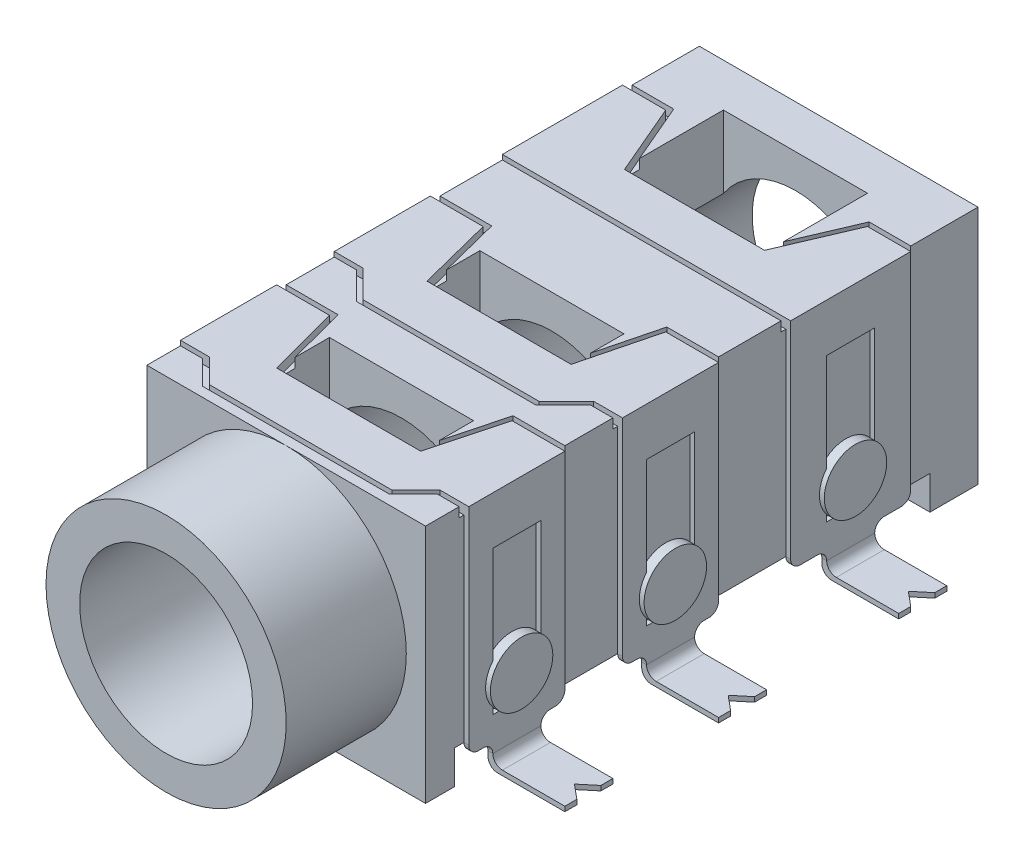
from build123d import *
from build123d.topology import SkipClean

# Parameters (mm, degrees)
CROQUIS1_W              = 5.8
CROQUIS1_H              = 5
CROQUIS1_R              = 1.8
SALIENTE_EXTRUIR1_DEPTH = 11.5
SALIENTE_EXTRUIR2_START = 2.5
CROQUIS2_R              = 2.5
CROQUIS2_R_2            = 1.8
SALIENTE_EXTRUIR2_DEPTH = 2.5
CROQUIS4_W              = 2
CROQUIS4_H              = 5
CROQUIS4_W_2            = 2.5
SALIENTE_EXTRUIR4_DEPTH = 0.1
CROQUIS5_W              = 1
CROQUIS5_H              = 0.1
SALIENTE_EXTRUIR5_DEPTH = 1.5
CROQUIS6_W              = 5.8
CROQUIS6_H              = 0.1
CORTAR_EXTRUIR1_DEPTH   = 0.2
CORTAR_EXTRUIR2_REACH   = 15.323
CROQUIS7_W              = 3
CROQUIS7_H              = 1
CROQUIS7_H_2            = 2
CROQUIS8_W              = 1
CROQUIS8_H              = 3
CORTAR_EXTRUIR3_DEPTH   = 0.1
CROQUIS9_R              = 0.65
SALIENTE_EXTRUIR8_DEPTH = 0.2
CORTAR_EXTRUIR4_START   = -0.6
CORTAR_EXTRUIR4_DEPTH   = 9.9
SALIENTE_EXTRUIR9_START = -0.115152
CROQUIS11_R             = 0.75
SALIENTE_EXTRUIR9_DEPTH = 1.115152
CORTAR_EXTRUIR5_REACH   = 15.286
CORTAR_EXTRUIR6_REACH   = 16.169
CROQUIS13_W             = 0.5
CROQUIS13_H             = 0.5
CROQUIS13_W_2           = 0.75
REDONDEO1_START         = -3.055616
REDONDEO1_DEPTH         = 0.155616
REDONDEO1_START_2       = 2.9
REDONDEO1_2_DEPTH       = 0.151008
REDONDEO1_START_3       = -2.909726
REDONDEO1_3_OUTLINE_W   = 0.1
REDONDEO1_3_OUTLINE_H   = 1
REDONDEO1_3_DEPTH       = 0.009726
REDONDEO1_4_OUTLINE_W   = 0.1
REDONDEO1_4_OUTLINE_H   = 1
REDONDEO1_4_DEPTH       = 0.009726
REDONDEO1_START_4       = -3
REDONDEO1_5_DEPTH       = 0.1
REDONDEO1_6_DEPTH       = 0.1
REDONDEO1_START_5       = -9.25
REDONDEO1_7_DEPTH       = 1
REDONDEO1_START_6       = -5.5
REDONDEO1_8_DEPTH       = 1
REDONDEO1_START_7       = -2.3
REDONDEO1_9_DEPTH       = 1
REDONDEO1_START_8       = -4
REDONDEO1_10_DEPTH      = 1.1
REDONDEO1_11_DEPTH      = 1.1
REDONDEO1_12_DEPTH      = 7.95


with BuildPart() as part:
    # Croquis1 → Saliente-Extruir1 (new body)
    with BuildSketch(Plane.XY):
        Rectangle(CROQUIS1_W, CROQUIS1_H)
        Circle(CROQUIS1_R, mode=Mode.SUBTRACT)
    extrude(amount=-SALIENTE_EXTRUIR1_DEPTH)

    # Croquis2 → Saliente-Extruir2 (add)
    with BuildSketch(Plane.XY.offset(SALIENTE_EXTRUIR2_START)):
        with Locations(Location((0, 0, 0), (0, 0, 270))):
            Circle(CROQUIS2_R)
        Circle(CROQUIS2_R_2, mode=Mode.SUBTRACT)
    extrude(amount=-SALIENTE_EXTRUIR2_DEPTH)

    # Croquis4 → Saliente-Extruir4 (add)
    with BuildSketch(Plane(origin=(2.9, 0, 0), x_dir=(0, 0, -1), z_dir=(1, 0, 0))):
        with Locations((1.8, 0)):
            Rectangle(CROQUIS4_W, CROQUIS4_H)
        with Locations((5, 0)):
            Rectangle(CROQUIS4_W, CROQUIS4_H)
        with Locations((8.75, 0)):
            Rectangle(CROQUIS4_W_2, CROQUIS4_H)
    saliente_extruir4 = extrude(amount=SALIENTE_EXTRUIR4_DEPTH)

    # Croquis5 → Saliente-Extruir5 (add)
    with BuildSketch(Plane(origin=(3, 0, 0), x_dir=(0, 0, -1), z_dir=(1, 0, 0))):
        with Locations((1.8, -2.45)):
            Rectangle(CROQUIS5_W, CROQUIS5_H)
        with Locations((5, -2.45)):
            Rectangle(CROQUIS5_W, CROQUIS5_H)
        with Locations((8.75, -2.45)):
            Rectangle(CROQUIS5_W, CROQUIS5_H)
    saliente_extruir5 = extrude(amount=SALIENTE_EXTRUIR5_DEPTH)

    # Simetría1: Saliente-Extruir4, Saliente-Extruir5 across plane
    add(saliente_extruir4.mirror(Plane(origin=(0, 0, 0), x_dir=(0, 0, 1), z_dir=(1, 0, 0))))
    add(saliente_extruir5.mirror(Plane(origin=(0, 0, 0), x_dir=(0, 0, 1), z_dir=(1, 0, 0))))

    # Croquis6 → Cortar-Extruir1 (cut)
    with BuildSketch(Plane(origin=(0, 2.5, 0), x_dir=(1, 0, 0), z_dir=(0, 1, 0))):
        Polygon((-2.9, 0.8), (-2.4, 0.8), (-1.9, 0.3), (1.9, 0.3), (2.4, 0.8), (2.9, 0.8), (2.9, 0.7), (2.441421356, 0.7), (1.941421356, 0.2), (-1.941421356, 0.2), (-2.441421356, 0.7), (-2.9, 0.7), align=None)
        Polygon((-2.9, 2.8), (-1.9, 2.8), (-1.5, 1.3), (1.5, 1.3), (1.9, 2.8), (2.9, 2.8), (2.9, 2.9), (1.823172169, 2.9), (1.423172169, 1.4), (-1.423172169, 1.4), (-1.823172169, 2.9), (-2.9, 2.9), align=None)
        Polygon((-2.9, 4), (-2.4, 4), (-1.830451108, 3.430451108), (1.830451108, 3.430451108), (2.4, 4), (2.9, 4), (2.9, 3.9), (2.441421356, 3.9), (1.871872464, 3.330451108), (-1.871872464, 3.330451108), (-2.441421356, 3.9), (-2.9, 3.9), align=None)
        Polygon((-2.9, 6), (-1.9, 6), (-1.5, 4.430451108), (1.5, 4.430451108), (1.9, 6), (2.9, 6), (2.9, 6.1), (1.822288679, 6.1), (1.422288679, 4.530451108), (-1.422288679, 4.530451108), (-1.822288679, 6.1), (-2.9, 6.1), align=None)
        with Locations((0, 7.45)):
            Rectangle(CROQUIS6_W, CROQUIS6_H)
        Polygon((-2.9, 10), (-2.1, 10), (-1.458102489, 8.5), (1.458102489, 8.5), (2.1, 10), (2.9, 10), (2.9, 10.1), (2.034021594, 10.1), (1.392124083, 8.6), (-1.392124083, 8.6), (-2.034021594, 10.1), (-2.9, 10.1), align=None)
    extrude(amount=-CORTAR_EXTRUIR1_DEPTH, mode=Mode.SUBTRACT)

    # Croquis7 → Cortar-Extruir2 (cut, up to next)
    with BuildSketch(Plane(origin=(0, 2.5, 0), x_dir=(1, 0, 0), z_dir=(0, 1, 0)), mode=Mode.PRIVATE) as cortar_extruir2_sk1:
        with Locations((0, 1.9)):
            Rectangle(CROQUIS7_W, CROQUIS7_H)
    cortar_extruir2_tool1 = extrude(cortar_extruir2_sk1.sketch, amount=-CORTAR_EXTRUIR2_REACH, mode=Mode.PRIVATE) & part.part
    # Croquis7 → Cortar-Extruir2 (cut, up to next)
    with BuildSketch(Plane(origin=(0, 2.5, 0), x_dir=(1, 0, 0), z_dir=(0, 1, 0)), mode=Mode.PRIVATE) as cortar_extruir2_sk2:
        with Locations((0, 5.030451108)):
            Rectangle(CROQUIS7_W, CROQUIS7_H)
    cortar_extruir2_tool2 = extrude(cortar_extruir2_sk2.sketch, amount=-CORTAR_EXTRUIR2_REACH, mode=Mode.PRIVATE) & part.part
    # Croquis7 → Cortar-Extruir2 (cut, up to next)
    with BuildSketch(Plane(origin=(0, 2.5, 0), x_dir=(1, 0, 0), z_dir=(0, 1, 0)), mode=Mode.PRIVATE) as cortar_extruir2_sk3:
        with Locations((0, 9.6)):
            Rectangle(CROQUIS7_W, CROQUIS7_H_2)
    cortar_extruir2_tool3 = extrude(cortar_extruir2_sk3.sketch, amount=-CORTAR_EXTRUIR2_REACH, mode=Mode.PRIVATE) & part.part
    add(cortar_extruir2_tool1.solids().sort_by_distance((0, 2.5, -1.9))[0], mode=Mode.SUBTRACT)
    add(cortar_extruir2_tool2.solids().sort_by_distance((0, 2.5, -5.030451))[0], mode=Mode.SUBTRACT)
    add(cortar_extruir2_tool3.solids().sort_by_distance((0, 2.5, -9.6))[0], mode=Mode.SUBTRACT)

    # Croquis8 → Cortar-Extruir3 (cut)
    with BuildSketch(Plane(origin=(3, 0, 0), x_dir=(0, 0, -1), z_dir=(1, 0, 0))):
        with Locations((1.8, 0)):
            Rectangle(CROQUIS8_W, CROQUIS8_H)
        with Locations((5, 0)):
            Rectangle(CROQUIS8_W, CROQUIS8_H)
        with Locations((8.75, 0)):
            Rectangle(CROQUIS8_W, CROQUIS8_H)
    cortar_extruir3 = extrude(amount=-CORTAR_EXTRUIR3_DEPTH, mode=Mode.SUBTRACT)

    # Simetría2: Cortar-Extruir3 across plane
    add(cortar_extruir3.mirror(Plane(origin=(0, 0, 0), x_dir=(0, 0, 1), z_dir=(1, 0, 0))), mode=Mode.SUBTRACT)

    # Croquis9 → Saliente-Extruir8 (add)
    with BuildSketch(Plane(origin=(2.9, 0, 0), x_dir=(0, 0, -1), z_dir=(1, 0, 0))):
        with Locations(Location((1.8, -0.95, 0), (0, 0, 219.715137232))):
            Circle(CROQUIS9_R)
        with Locations(Location((5, -0.95, 0), (0, 0, 219.715137232))):
            Circle(CROQUIS9_R)
        with Locations(Location((8.75, -0.95, 0), (0, 0, 219.715137232))):
            Circle(CROQUIS9_R)
    saliente_extruir8 = extrude(amount=SALIENTE_EXTRUIR8_DEPTH)

    # Simetría3: Saliente-Extruir8 across plane
    add(saliente_extruir8.mirror(Plane(origin=(0, 0, 0), x_dir=(0, 0, 1), z_dir=(1, 0, 0))))

    # Croquis10 → Cortar-Extruir4 (cut)
    with BuildSketch(Plane.XY.offset(CORTAR_EXTRUIR4_START)):
        with BuildLine():
            Line((-2.9, -2.5), (0, -2.5))
            ThreePointArc((0, -2.5), (-0.935414347, -2.318404624), (-1.734935157, -1.8))
            Line((-1.734935157, -1.8), (-2.9, -1.8))
            Line((-2.9, -1.8), (-2.9, -2.5))
        make_face()
        with BuildLine():
            Line((2.9, -1.8), (1.734935157, -1.8))
            ThreePointArc((1.734935157, -1.8), (0.935414347, -2.318404624), (0, -2.5))
            Line((0, -2.5), (2.9, -2.5))
            Line((2.9, -2.5), (2.9, -1.8))
        make_face()
    extrude(amount=-CORTAR_EXTRUIR4_DEPTH, mode=Mode.SUBTRACT)

    # Croquis11 → Saliente-Extruir9 (add)
    with SkipClean():  # the faces are left unmerged after this step: merging them gives an invalid solid
        with BuildSketch(Plane.XZ.offset(2.5).offset(SALIENTE_EXTRUIR9_START)):
            with Locations((0, -2.5)):
                Circle(CROQUIS11_R)
            with Locations((0, -8.5)):
                Circle(CROQUIS11_R)
        extrude(amount=SALIENTE_EXTRUIR9_DEPTH)

    # Croquis12 → Cortar-Extruir5 (cut, up to next)
    with BuildSketch(Plane(origin=(0, -2.4, 0), x_dir=(1, 0, 0), z_dir=(0, 1, 0)), mode=Mode.PRIVATE) as cortar_extruir5_sk1:
        Polygon((4.5, 2.05), (4.2, 1.8), (4.5, 1.55), align=None)
    cortar_extruir5_tool1 = extrude(cortar_extruir5_sk1.sketch, amount=-CORTAR_EXTRUIR5_REACH, mode=Mode.PRIVATE) & part.part
    # Croquis12 → Cortar-Extruir5 (cut, up to next)
    with BuildSketch(Plane(origin=(0, -2.4, 0), x_dir=(1, 0, 0), z_dir=(0, 1, 0)), mode=Mode.PRIVATE) as cortar_extruir5_sk2:
        Polygon((4.5, 5.25), (4.2, 5), (4.5, 4.75), align=None)
    cortar_extruir5_tool2 = extrude(cortar_extruir5_sk2.sketch, amount=-CORTAR_EXTRUIR5_REACH, mode=Mode.PRIVATE) & part.part
    # Croquis12 → Cortar-Extruir5 (cut, up to next)
    with BuildSketch(Plane(origin=(0, -2.4, 0), x_dir=(1, 0, 0), z_dir=(0, 1, 0)), mode=Mode.PRIVATE) as cortar_extruir5_sk3:
        Polygon((4.5, 9), (4.2, 8.75), (4.5, 8.5), align=None)
    cortar_extruir5_tool3 = extrude(cortar_extruir5_sk3.sketch, amount=-CORTAR_EXTRUIR5_REACH, mode=Mode.PRIVATE) & part.part
    # Croquis12 → Cortar-Extruir5 (cut, up to next)
    with BuildSketch(Plane(origin=(0, -2.4, 0), x_dir=(1, 0, 0), z_dir=(0, 1, 0)), mode=Mode.PRIVATE) as cortar_extruir5_sk4:
        Polygon((-4.5, 8.5), (-4.5, 9), (-4.2, 8.75), align=None)
    cortar_extruir5_tool4 = extrude(cortar_extruir5_sk4.sketch, amount=-CORTAR_EXTRUIR5_REACH, mode=Mode.PRIVATE) & part.part
    # Croquis12 → Cortar-Extruir5 (cut, up to next)
    with BuildSketch(Plane(origin=(0, -2.4, 0), x_dir=(1, 0, 0), z_dir=(0, 1, 0)), mode=Mode.PRIVATE) as cortar_extruir5_sk5:
        Polygon((-4.5, 4.75), (-4.5, 5.25), (-4.2, 5), align=None)
    cortar_extruir5_tool5 = extrude(cortar_extruir5_sk5.sketch, amount=-CORTAR_EXTRUIR5_REACH, mode=Mode.PRIVATE) & part.part
    # Croquis12 → Cortar-Extruir5 (cut, up to next)
    with BuildSketch(Plane(origin=(0, -2.4, 0), x_dir=(1, 0, 0), z_dir=(0, 1, 0)), mode=Mode.PRIVATE) as cortar_extruir5_sk6:
        Polygon((-4.5, 1.55), (-4.5, 2.05), (-4.2, 1.8), align=None)
    cortar_extruir5_tool6 = extrude(cortar_extruir5_sk6.sketch, amount=-CORTAR_EXTRUIR5_REACH, mode=Mode.PRIVATE) & part.part
    add(cortar_extruir5_tool1.solids().sort_by_distance((4.4, -2.4, -1.8))[0], mode=Mode.SUBTRACT)
    add(cortar_extruir5_tool2.solids().sort_by_distance((4.4, -2.4, -5))[0], mode=Mode.SUBTRACT)
    add(cortar_extruir5_tool3.solids().sort_by_distance((4.4, -2.4, -8.75))[0], mode=Mode.SUBTRACT)
    add(cortar_extruir5_tool4.solids().sort_by_distance((-4.4, -2.4, -8.75))[0], mode=Mode.SUBTRACT)
    add(cortar_extruir5_tool5.solids().sort_by_distance((-4.4, -2.4, -5))[0], mode=Mode.SUBTRACT)
    add(cortar_extruir5_tool6.solids().sort_by_distance((-4.4, -2.4, -1.8))[0], mode=Mode.SUBTRACT)

    # Croquis13 → Cortar-Extruir6 (cut, up to next)
    with BuildSketch(Plane(origin=(3, 0, 0), x_dir=(0, 0, -1), z_dir=(1, 0, 0)), mode=Mode.PRIVATE) as cortar_extruir6_sk1:
        with Locations((1.05, -2.25)):
            Rectangle(CROQUIS13_W, CROQUIS13_H)
    cortar_extruir6_tool1 = extrude(cortar_extruir6_sk1.sketch, amount=-CORTAR_EXTRUIR6_REACH, mode=Mode.PRIVATE) & part.part
    # Croquis13 → Cortar-Extruir6 (cut, up to next)
    with BuildSketch(Plane(origin=(3, 0, 0), x_dir=(0, 0, -1), z_dir=(1, 0, 0)), mode=Mode.PRIVATE) as cortar_extruir6_sk2:
        with Locations((2.55, -2.25)):
            Rectangle(CROQUIS13_W, CROQUIS13_H)
    cortar_extruir6_tool2 = extrude(cortar_extruir6_sk2.sketch, amount=-CORTAR_EXTRUIR6_REACH, mode=Mode.PRIVATE) & part.part
    # Croquis13 → Cortar-Extruir6 (cut, up to next)
    with BuildSketch(Plane(origin=(3, 0, 0), x_dir=(0, 0, -1), z_dir=(1, 0, 0)), mode=Mode.PRIVATE) as cortar_extruir6_sk3:
        with Locations((4.25, -2.25)):
            Rectangle(CROQUIS13_W, CROQUIS13_H)
    cortar_extruir6_tool3 = extrude(cortar_extruir6_sk3.sketch, amount=-CORTAR_EXTRUIR6_REACH, mode=Mode.PRIVATE) & part.part
    # Croquis13 → Cortar-Extruir6 (cut, up to next)
    with BuildSketch(Plane(origin=(3, 0, 0), x_dir=(0, 0, -1), z_dir=(1, 0, 0)), mode=Mode.PRIVATE) as cortar_extruir6_sk4:
        with Locations((5.75, -2.25)):
            Rectangle(CROQUIS13_W, CROQUIS13_H)
    cortar_extruir6_tool4 = extrude(cortar_extruir6_sk4.sketch, amount=-CORTAR_EXTRUIR6_REACH, mode=Mode.PRIVATE) & part.part
    # Croquis13 → Cortar-Extruir6 (cut, up to next)
    with BuildSketch(Plane(origin=(3, 0, 0), x_dir=(0, 0, -1), z_dir=(1, 0, 0)), mode=Mode.PRIVATE) as cortar_extruir6_sk5:
        with Locations((7.875, -2.25)):
            Rectangle(CROQUIS13_W_2, CROQUIS13_H)
    cortar_extruir6_tool5 = extrude(cortar_extruir6_sk5.sketch, amount=-CORTAR_EXTRUIR6_REACH, mode=Mode.PRIVATE) & part.part
    # Croquis13 → Cortar-Extruir6 (cut, up to next)
    with BuildSketch(Plane(origin=(3, 0, 0), x_dir=(0, 0, -1), z_dir=(1, 0, 0)), mode=Mode.PRIVATE) as cortar_extruir6_sk6:
        with Locations((9.625, -2.25)):
            Rectangle(CROQUIS13_W_2, CROQUIS13_H)
    cortar_extruir6_tool6 = extrude(cortar_extruir6_sk6.sketch, amount=-CORTAR_EXTRUIR6_REACH, mode=Mode.PRIVATE) & part.part
    cortar_extruir6_1 = cortar_extruir6_tool1.solids().sort_by_distance((3, -2.25, -1.05))[0]
    add(cortar_extruir6_1, mode=Mode.SUBTRACT)
    cortar_extruir6_2 = cortar_extruir6_tool2.solids().sort_by_distance((3, -2.25, -2.55))[0]
    add(cortar_extruir6_2, mode=Mode.SUBTRACT)
    cortar_extruir6_3 = cortar_extruir6_tool3.solids().sort_by_distance((3, -2.25, -4.25))[0]
    add(cortar_extruir6_3, mode=Mode.SUBTRACT)
    cortar_extruir6_4 = cortar_extruir6_tool4.solids().sort_by_distance((3, -2.25, -5.75))[0]
    add(cortar_extruir6_4, mode=Mode.SUBTRACT)
    cortar_extruir6_5 = cortar_extruir6_tool5.solids().sort_by_distance((3, -2.25, -7.875))[0]
    add(cortar_extruir6_5, mode=Mode.SUBTRACT)
    cortar_extruir6_6 = cortar_extruir6_tool6.solids().sort_by_distance((3, -2.25, -9.625))[0]
    add(cortar_extruir6_6, mode=Mode.SUBTRACT)
    cortar_extruir6 = cortar_extruir6_1 + cortar_extruir6_2 + cortar_extruir6_3 + cortar_extruir6_4 + cortar_extruir6_5 + cortar_extruir6_6  # Cortar-Extruir6 as one shape, for the pattern or mirror that repeats it

    # Simetría4: Cortar-Extruir6 across plane
    with SkipClean():  # the faces are left unmerged after this step: merging them gives an invalid solid
        add(cortar_extruir6.mirror(Plane(origin=(0, 0, 0), x_dir=(0, 0, 1), z_dir=(1, 0, 0))), mode=Mode.SUBTRACT)

    # Redondeo1: read off the stored shape, not the designer's step
    # Redondeo1 outline → Redondeo1 (cut)
    with SkipClean():  # the faces are left unmerged after this step: merging them gives an invalid solid
        with BuildSketch(Plane.YZ.offset(REDONDEO1_START)):
            with BuildLine():
                Line((-2, -0.8), (-2, -1))
                ThreePointArc((-2, -1), (-1.941421356, -0.858578644), (-1.8, -0.8))
                Line((-1.8, -0.8), (-2, -0.8))
            make_face()
            with BuildLine():
                ThreePointArc((-1.8, -2.8), (-1.941421356, -2.741421356), (-2, -2.6))
                Line((-2, -2.6), (-2, -2.8))
                Line((-2, -2.8), (-1.8, -2.8))
            make_face()
            with BuildLine():
                Line((-2, -4), (-2, -4.2))
                ThreePointArc((-2, -4.2), (-1.941421356, -4.058578644), (-1.8, -4))
                Line((-1.8, -4), (-2, -4))
            make_face()
            with BuildLine():
                ThreePointArc((-1.8, -6), (-1.941421356, -5.941421356), (-2, -5.8))
                Line((-2, -5.8), (-2, -6))
                Line((-2, -6), (-1.8, -6))
            make_face()
            with BuildLine():
                ThreePointArc((-1.8, -10), (-1.941421356, -9.941421356), (-2, -9.8))
                Line((-2, -9.8), (-2, -10))
                Line((-2, -10), (-1.8, -10))
            make_face()
        extrude(amount=REDONDEO1_DEPTH, mode=Mode.SUBTRACT)

    # Redondeo1 2 outline → Redondeo1 2 (cut)
    with SkipClean():  # the faces are left unmerged after this step: merging them gives an invalid solid
        with BuildSketch(Plane.YZ.offset(REDONDEO1_START_2)):
            with BuildLine():
                Line((-2, -0.8), (-2, -1))
                ThreePointArc((-2, -1), (-1.941421356, -0.858578644), (-1.8, -0.8))
                Line((-1.8, -0.8), (-2, -0.8))
            make_face()
            with BuildLine():
                ThreePointArc((-1.8, -2.8), (-1.941421356, -2.741421356), (-2, -2.6))
                Line((-2, -2.6), (-2, -2.8))
                Line((-2, -2.8), (-1.8, -2.8))
            make_face()
            with BuildLine():
                Line((-2, -4), (-2, -4.2))
                ThreePointArc((-2, -4.2), (-1.941421356, -4.058578644), (-1.8, -4))
                Line((-1.8, -4), (-2, -4))
            make_face()
            with BuildLine():
                ThreePointArc((-1.8, -6), (-1.941421356, -5.941421356), (-2, -5.8))
                Line((-2, -5.8), (-2, -6))
                Line((-2, -6), (-1.8, -6))
            make_face()
            with BuildLine():
                ThreePointArc((-1.8, -10), (-1.941421356, -9.941421356), (-2, -9.8))
                Line((-2, -9.8), (-2, -10))
                Line((-2, -10), (-1.8, -10))
            make_face()
        extrude(amount=REDONDEO1_2_DEPTH, mode=Mode.SUBTRACT)

    # Redondeo1 3 outline → Redondeo1 3 (cut)
    with SkipClean():  # the faces are left unmerged after this step: merging them gives an invalid solid
        with BuildSketch(Plane.YZ.offset(REDONDEO1_START_3)):
            with Locations((-2.45, -1.8)):
                Rectangle(REDONDEO1_3_OUTLINE_W, REDONDEO1_3_OUTLINE_H)
            with Locations((-2.45, -5)):
                Rectangle(REDONDEO1_3_OUTLINE_W, REDONDEO1_3_OUTLINE_H)
            with Locations((-2.45, -8.75)):
                Rectangle(REDONDEO1_3_OUTLINE_W, REDONDEO1_3_OUTLINE_H)
        extrude(amount=REDONDEO1_3_DEPTH, mode=Mode.SUBTRACT)

    # Redondeo1 4 outline → Redondeo1 4 (cut)
    with SkipClean():  # the faces are left unmerged after this step: merging them gives an invalid solid
        with BuildSketch(Plane.YZ.offset(REDONDEO1_START_2)):
            with Locations((-2.45, -1.8)):
                Rectangle(REDONDEO1_4_OUTLINE_W, REDONDEO1_4_OUTLINE_H)
            with Locations((-2.45, -5)):
                Rectangle(REDONDEO1_4_OUTLINE_W, REDONDEO1_4_OUTLINE_H)
            with Locations((-2.45, -8.75)):
                Rectangle(REDONDEO1_4_OUTLINE_W, REDONDEO1_4_OUTLINE_H)
        extrude(amount=REDONDEO1_4_DEPTH, mode=Mode.SUBTRACT)

    # Redondeo1 5 outline → Redondeo1 5 (add)
    with SkipClean():  # the faces are left unmerged after this step: merging them gives an invalid solid
        with BuildSketch(Plane.YZ.offset(REDONDEO1_START_4)):
            with BuildLine():
                ThreePointArc((-2, -1.1), (-2.058578644, -1.241421356), (-2.2, -1.3))
                Line((-2.2, -1.3), (-2, -1.3))
                Line((-2, -1.3), (-2, -1.1))
            make_face()
            with BuildLine():
                Line((-2, -2.3), (-2.2, -2.3))
                ThreePointArc((-2.2, -2.3), (-2.058578644, -2.358578644), (-2, -2.5))
                Line((-2, -2.5), (-2, -2.3))
            make_face()
            with BuildLine():
                ThreePointArc((-2, -4.3), (-2.058578644, -4.441421356), (-2.2, -4.5))
                Line((-2.2, -4.5), (-2, -4.5))
                Line((-2, -4.5), (-2, -4.3))
            make_face()
            with BuildLine():
                Line((-2, -5.5), (-2.2, -5.5))
                ThreePointArc((-2.2, -5.5), (-2.058578644, -5.558578644), (-2, -5.7))
                Line((-2, -5.7), (-2, -5.5))
            make_face()
            with BuildLine():
                ThreePointArc((-2, -8.05), (-2.058578644, -8.191421356), (-2.2, -8.25))
                Line((-2.2, -8.25), (-2, -8.25))
                Line((-2, -8.25), (-2, -8.05))
            make_face()
            with BuildLine():
                Line((-2, -9.25), (-2.2, -9.25))
                ThreePointArc((-2.2, -9.25), (-2.058578644, -9.308578644), (-2, -9.45))
                Line((-2, -9.45), (-2, -9.25))
            make_face()
        extrude(amount=REDONDEO1_5_DEPTH)

    # Redondeo1 6 outline → Redondeo1 6 (add)
    with SkipClean():  # the faces are left unmerged after this step: merging them gives an invalid solid
        with BuildSketch(Plane.YZ.offset(REDONDEO1_START_2)):
            with BuildLine():
                ThreePointArc((-2, -1.1), (-2.058578644, -1.241421356), (-2.2, -1.3))
                Line((-2.2, -1.3), (-2, -1.3))
                Line((-2, -1.3), (-2, -1.1))
            make_face()
            with BuildLine():
                Line((-2, -2.3), (-2.2, -2.3))
                ThreePointArc((-2.2, -2.3), (-2.058578644, -2.358578644), (-2, -2.5))
                Line((-2, -2.5), (-2, -2.3))
            make_face()
            with BuildLine():
                ThreePointArc((-2, -4.3), (-2.058578644, -4.441421356), (-2.2, -4.5))
                Line((-2.2, -4.5), (-2, -4.5))
                Line((-2, -4.5), (-2, -4.3))
            make_face()
            with BuildLine():
                Line((-2, -5.5), (-2.2, -5.5))
                ThreePointArc((-2.2, -5.5), (-2.058578644, -5.558578644), (-2, -5.7))
                Line((-2, -5.7), (-2, -5.5))
            make_face()
            with BuildLine():
                ThreePointArc((-2, -8.05), (-2.058578644, -8.191421356), (-2.2, -8.25))
                Line((-2.2, -8.25), (-2, -8.25))
                Line((-2, -8.25), (-2, -8.05))
            make_face()
            with BuildLine():
                Line((-2, -9.25), (-2.2, -9.25))
                ThreePointArc((-2.2, -9.25), (-2.058578644, -9.308578644), (-2, -9.45))
                Line((-2, -9.45), (-2, -9.25))
            make_face()
        extrude(amount=REDONDEO1_6_DEPTH)

    # Redondeo1 7 outline → Redondeo1 7 (add)
    with SkipClean():  # the faces are left unmerged after this step: merging them gives an invalid solid
        with BuildSketch(Plane.XY.offset(REDONDEO1_START_5)):
            with BuildLine():
                ThreePointArc((3.2, -2.4), (3.058578644, -2.341421356), (3, -2.2))
                Line((3, -2.2), (3, -2.4))
                Line((3, -2.4), (3.2, -2.4))
            make_face()
            with BuildLine():
                Line((-3, -2.4), (-3, -2.2))
                ThreePointArc((-3, -2.2), (-3.058578644, -2.341421356), (-3.2, -2.4))
                Line((-3.2, -2.4), (-3, -2.4))
            make_face()
        extrude(amount=REDONDEO1_7_DEPTH)

    # Redondeo1 8 outline → Redondeo1 8 (add)
    with SkipClean():  # the faces are left unmerged after this step: merging them gives an invalid solid
        with BuildSketch(Plane.XY.offset(REDONDEO1_START_6)):
            with BuildLine():
                ThreePointArc((3.2, -2.4), (3.058578644, -2.341421356), (3, -2.2))
                Line((3, -2.2), (3, -2.4))
                Line((3, -2.4), (3.2, -2.4))
            make_face()
            with BuildLine():
                Line((-3, -2.4), (-3, -2.2))
                ThreePointArc((-3, -2.2), (-3.058578644, -2.341421356), (-3.2, -2.4))
                Line((-3.2, -2.4), (-3, -2.4))
            make_face()
        extrude(amount=REDONDEO1_8_DEPTH)

    # Redondeo1 9 outline → Redondeo1 9 (add)
    with SkipClean():  # the faces are left unmerged after this step: merging them gives an invalid solid
        with BuildSketch(Plane.XY.offset(REDONDEO1_START_7)):
            with BuildLine():
                ThreePointArc((3.2, -2.4), (3.058578644, -2.341421356), (3, -2.2))
                Line((3, -2.2), (3, -2.4))
                Line((3, -2.4), (3.2, -2.4))
            make_face()
            with BuildLine():
                Line((-3, -2.4), (-3, -2.2))
                ThreePointArc((-3, -2.2), (-3.058578644, -2.341421356), (-3.2, -2.4))
                Line((-3.2, -2.4), (-3, -2.4))
            make_face()
        extrude(amount=REDONDEO1_9_DEPTH)

    # Redondeo1 10 outline → Redondeo1 10 (cut)
    with SkipClean():  # the faces are left unmerged after this step: merging them gives an invalid solid
        with BuildSketch(Plane.YZ.offset(REDONDEO1_START_8)):
            with BuildLine():
                ThreePointArc((-2, -7.7), (-1.941421356, -7.558578644), (-1.8, -7.5))
                Line((-1.8, -7.5), (-2, -7.5))
                Line((-2, -7.5), (-2, -7.7))
            make_face()
        extrude(amount=REDONDEO1_10_DEPTH, mode=Mode.SUBTRACT)

    # Redondeo1 11 outline → Redondeo1 11 (cut)
    with SkipClean():  # the faces are left unmerged after this step: merging them gives an invalid solid
        with BuildSketch(Plane.YZ.offset(REDONDEO1_START_2)):
            with BuildLine():
                ThreePointArc((-2, -7.7), (-1.941421356, -7.558578644), (-1.8, -7.5))
                Line((-1.8, -7.5), (-2, -7.5))
                Line((-2, -7.5), (-2, -7.7))
            make_face()
        extrude(amount=REDONDEO1_11_DEPTH, mode=Mode.SUBTRACT)

    # Redondeo1 12 outline → Redondeo1 12 (cut)
    with SkipClean():  # the faces are left unmerged after this step: merging them gives an invalid solid
        with BuildSketch(Plane.XY.offset(REDONDEO1_START_5)):
            with BuildLine():
                ThreePointArc((3.1, -2.5), (2.958578644, -2.441421356), (2.9, -2.3))
                Line((2.9, -2.3), (2.9, -2.4))
                Line((2.9, -2.4), (2.909726, -2.4))
                Line((2.909726, -2.4), (2.909726, -2.5))
                Line((2.909726, -2.5), (3.1, -2.5))
            make_face()
            with BuildLine():
                ThreePointArc((-2.9, -2.3), (-2.958578644, -2.441421356), (-3.1, -2.5))
                Line((-3.1, -2.5), (-2.909726, -2.5))
                Line((-2.909726, -2.5), (-2.909726, -2.4))
                Line((-2.909726, -2.4), (-2.9, -2.4))
                Line((-2.9, -2.4), (-2.9, -2.3))
            make_face()
        extrude(amount=REDONDEO1_12_DEPTH, mode=Mode.SUBTRACT)


solid = part.part
